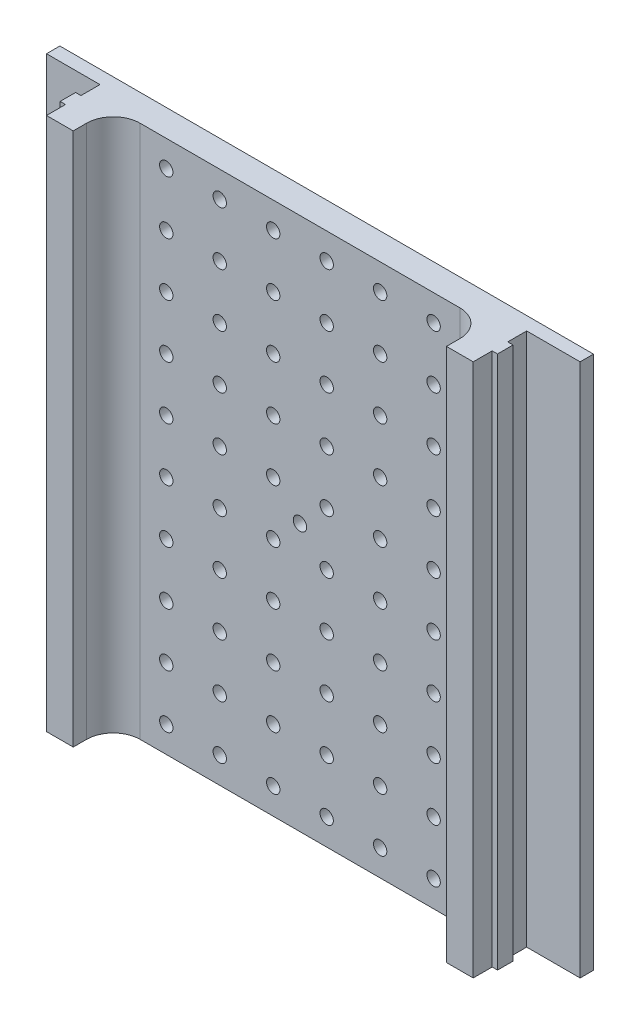
from build123d import *

# Parameters (mm, degrees)
SKETCH1_W            = 99.8
SKETCH1_H            = 99.8
MAIN_DEPTH           = 12.5
CUT_EXTRUDE1_DEPTH   = 113.277780527
SKETCH3_W            = 69.8
SKETCH3_H            = 7.5
CUT_EXTRUDE2_DEPTH   = 113.277780527
FILLET1_R            = 5
SKETCH4_R            = 1.25
FIXHOLE_DEPTH        = 71.966682323
LPATTERN1_COUNT      = 6
LPATTERN1_PITCH      = 10
LPATTERN1_COUNT_DIR2 = 10
LPATTERN1_PITCH_DIR2 = 10
SKETCH6_R            = 1.25
CUT_EXTRUDE4_DEPTH   = 71.966682323


with BuildPart() as part:
    # Sketch1 → Main (new body)
    with BuildSketch(Plane.XY):
        Rectangle(SKETCH1_W, SKETCH1_H)
    extrude(amount=MAIN_DEPTH)

    # Sketch2 → Cut-Extrude1 (cut, symmetric)
    with BuildSketch(Plane(origin=(0, 49.9, 0), x_dir=(1, 0, 0), z_dir=(0, 1, 0))):
        Polygon((-39.9, -8.95), (-39.9, -12.5), (-49.9, -12.5), (-49.9, -2.5), (-39.9, -2.5), (-39.9, -6.05), (-40.9, -6.05), (-40.9, -8.95), align=None)
    cut_extrude1 = extrude(amount=CUT_EXTRUDE1_DEPTH, both=True, mode=Mode.SUBTRACT)

    # Mirror1: Cut-Extrude1 across plane
    add(cut_extrude1.mirror(Plane(origin=(0, 0, 0), x_dir=(0, 0, 1), z_dir=(1, 0, 0))), mode=Mode.SUBTRACT)

    # Sketch3 → Cut-Extrude2 (cut, through all)
    with BuildSketch(Plane(origin=(0, 49.9, 0), x_dir=(1, 0, 0), z_dir=(0, 1, 0))):
        with Locations((0, -8.75)):
            Rectangle(SKETCH3_W, SKETCH3_H)
    extrude(amount=-CUT_EXTRUDE2_DEPTH, mode=Mode.SUBTRACT)

    # Fillet1
    fillet1_edges = [part.edges().sort_by_distance(p)[0] for p in [
        (-34.9, 0, 5),
        (34.9, 0, 5),
    ]]
    fillet(fillet1_edges, radius=FILLET1_R)

    # Sketch4 → FixHole (cut, through all)
    with BuildSketch(Plane.XY.offset(5)):
        with Locations((25, -45)):
            Circle(SKETCH4_R)
    fixhole = extrude(amount=-FIXHOLE_DEPTH, mode=Mode.SUBTRACT)

    # LPattern1: FixHole 6 × 10
    with Locations(*[(-i * LPATTERN1_PITCH, j * LPATTERN1_PITCH_DIR2, 0) for i in range(LPATTERN1_COUNT) for j in range(LPATTERN1_COUNT_DIR2) if (i, j) != (0, 0)]):
        add(fixhole, mode=Mode.SUBTRACT)

    # Sketch6 → Cut-Extrude4 (cut, through all)
    with BuildSketch(Plane.XY.offset(5)):
        Circle(SKETCH6_R)
    extrude(amount=-CUT_EXTRUDE4_DEPTH, mode=Mode.SUBTRACT)


solid = part.part
